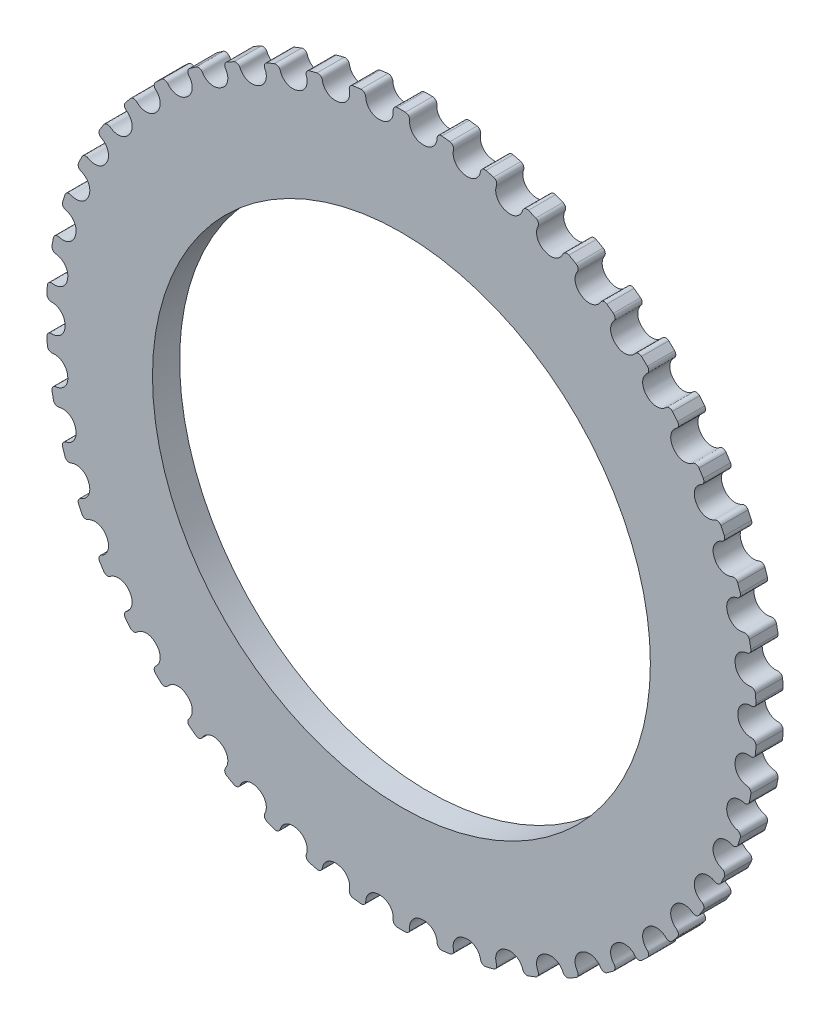
from build123d import *

# Parameters (mm, degrees)
SKETCHREVOLVEGEARBELT01_W       = 3
SKETCHREVOLVEGEARBELT01_H       = 39.217218411
TOOTHEXTRUDECUTGEARBELT01_DEPTH = 7.238999891
PATTERNGEARBELT01_COUNT         = 50
BOREREVOLVESKETCH_W             = 14.477999782
BOREREVOLVESKETCH_H             = 27.5


with BuildPart() as part:
    # SketchRevolveGearBelt01 → GearBelt01 (revolve)
    with BuildSketch(Plane(origin=(0, 0, 0), x_dir=(0, 0, -1), z_dir=(1, 0, 0))):
        with Locations((0, 19.608609206)):
            Rectangle(SKETCHREVOLVEGEARBELT01_W, SKETCHREVOLVEGEARBELT01_H)
    revolve(axis=Axis((0, 0, 0), (0, 0, -1)))

    # SketchToothGearBelt01 → ToothExtrudeCutGearBelt01 (cut, symmetric)
    with BuildSketch(Plane.XY):
        with BuildLine():
            ThreePointArc((39.164679022, 2.032334243), (39.217374535, 0), (39.164679022, -2.032334243))
            add(Edge.make_bspline(
                [(39.164679022, -2.032334243), (39.166048883, -2.005984565), (39.164883295, -1.966294001), (39.156943231, -1.91408071), (39.147835553, -1.875531869), (39.135634795, -1.83784758), (39.12042125, -1.801275572), (39.102294908, -1.766056265), (39.081374934, -1.732421187), (39.057798852, -1.700591449), (39.031721649, -1.670776298), (39.003314752, -1.64317173), (38.972764904, -1.617959231), (38.940272938, -1.59530448), (38.906052449, -1.575356646), (38.870328405, -1.558245974), (38.833335623, -1.544088262), (38.795317397, -1.532964211), (38.756523252, -1.524993116), (38.717209712, -1.520055082), (38.66580266, -1.5184582), (38.589994052, -1.519756698), (38.489697952, -1.516042965), (38.377509936, -1.502613699), (38.266707897, -1.480535762), (38.157982142, -1.449806634), (38.052000418, -1.410652745), (37.949416183, -1.363305357), (37.850861265, -1.308058822), (37.756942857, -1.245252774), (37.668239537, -1.175274325), (37.585297771, -1.098554529), (37.50862852, -1.015566038), (37.43870413, -0.926820101), (37.375955295, -0.832863447), (37.320768875, -0.73427489), (37.27348376, -0.631661826), (37.234395318, -0.525656278), (37.203729181, -0.416911781), (37.181730901, -0.306096466), (37.168324647, -0.193899714), (37.165224472, -0.105119728), (37.165512565, -0.040500395), (37.16545238, 0), (37.165512565, 0.040500395), (37.165224472, 0.105119728), (37.168324647, 0.193899714), (37.181730901, 0.306096466), (37.203729181, 0.416911781), (37.234395318, 0.525656278), (37.27348376, 0.631661826), (37.320768875, 0.73427489), (37.375955295, 0.832863447), (37.43870413, 0.926820101), (37.50862852, 1.015566038), (37.585297771, 1.098554529), (37.668239537, 1.175274325), (37.756942857, 1.245252774), (37.850861265, 1.308058822), (37.949416183, 1.363305357), (38.052000418, 1.410652745), (38.157982142, 1.449806634), (38.266707897, 1.480535762), (38.377509936, 1.502613699), (38.489697952, 1.516042965), (38.589994052, 1.519756698), (38.66580266, 1.5184582), (38.717209712, 1.520055082), (38.756523252, 1.524993116), (38.795317397, 1.532964211), (38.833335623, 1.544088262), (38.870328405, 1.558245974), (38.906052449, 1.575356646), (38.940272938, 1.59530448), (38.972764904, 1.617959231), (39.003314752, 1.64317173), (39.031721649, 1.670776298), (39.057798852, 1.700591449), (39.081374934, 1.732421187), (39.102294908, 1.766056265), (39.12042125, 1.801275572), (39.135634795, 1.83784758), (39.147835553, 1.875531869), (39.156943231, 1.91408071), (39.164883295, 1.966294001), (39.166048883, 2.005984565), (39.164679022, 2.032334243)],
                knots=[0, 0, 0, 0, 0.012346399, 0.018519598, 0.024692797, 0.030865997, 0.037039196, 0.043212395, 0.049385595, 0.055558794, 0.061731993, 0.067905193, 0.074078392, 0.080251591, 0.086424791, 0.09259799, 0.09877119, 0.104944389, 0.111117588, 0.117290788, 0.123463987, 0.135171051, 0.152780618, 0.170390185, 0.187999752, 0.205609319, 0.223218886, 0.240828453, 0.25843802, 0.276047587, 0.293657154, 0.311266721, 0.328876288, 0.346485855, 0.364095422, 0.381704989, 0.399314555, 0.416924122, 0.434533689, 0.452143256, 0.469752823, 0.48736239, 0.493681195, 0.5, 0.506318805, 0.51263761, 0.530247177, 0.547856744, 0.565466311, 0.583075878, 0.600685445, 0.618295011, 0.635904578, 0.653514145, 0.671123712, 0.688733279, 0.706342846, 0.723952413, 0.74156198, 0.759171547, 0.776781114, 0.794390681, 0.812000248, 0.829609815, 0.847219382, 0.864828949, 0.876536013, 0.882709212, 0.888882412, 0.895055611, 0.90122881, 0.90740201, 0.913575209, 0.919748409, 0.925921608, 0.932094807, 0.938268007, 0.944441206, 0.950614405, 0.956787605, 0.962960804, 0.969134003, 0.975307203, 0.981480402, 0.987653601, 1, 1, 1, 1], degree=3))
        make_face()
    toothextrudecutgearbelt01 = extrude(amount=TOOTHEXTRUDECUTGEARBELT01_DEPTH, both=True, mode=Mode.SUBTRACT)

    # PatternGearBelt01: ToothExtrudeCutGearBelt01 ×50 about axis
    patterngearbelt01_axis = Axis((0, 0, 55), (0, 0, -1))
    for i in range(1, PATTERNGEARBELT01_COUNT):
        add(toothextrudecutgearbelt01.rotate(patterngearbelt01_axis, i * 360 / PATTERNGEARBELT01_COUNT), mode=Mode.SUBTRACT)

    # BoreRevolveSketch → BoreRevolveCut (revolve, cut)
    with BuildSketch(Plane(origin=(0, 0, 0), x_dir=(0, 0, -1), z_dir=(1, 0, 0))):
        with Locations((0, 13.75)):
            Rectangle(BOREREVOLVESKETCH_W, BOREREVOLVESKETCH_H)
    revolve(axis=Axis((0, 0, 0), (0, 0, -1)), mode=Mode.SUBTRACT)


solid = part.part
